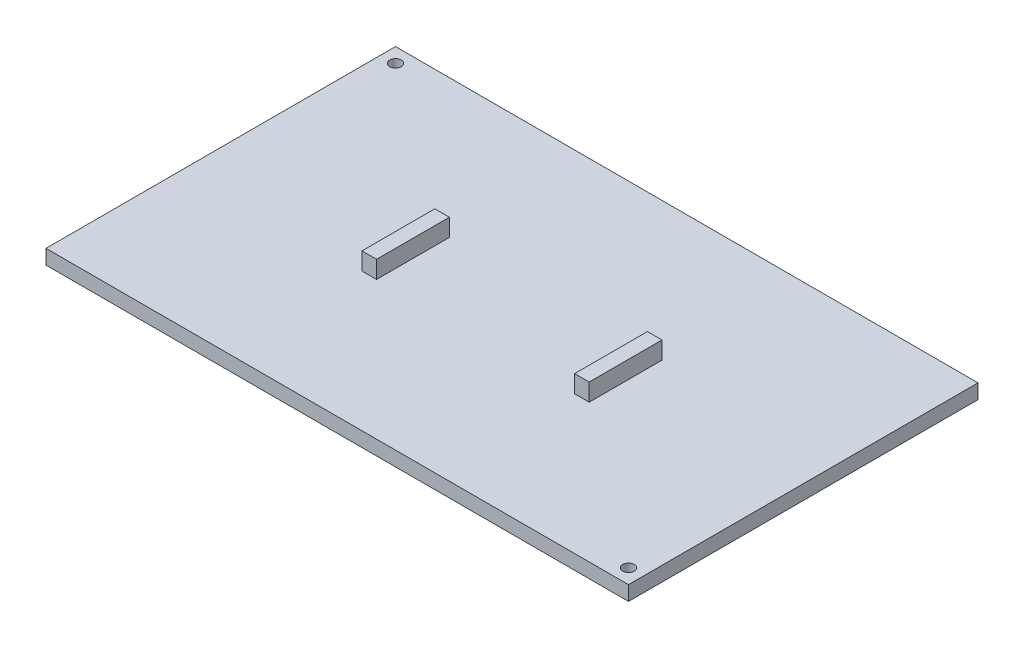
from build123d import *

# Parameters (mm, degrees)
SKETCH2_W           = 100
SKETCH2_H           = 60
BOSS_EXTRUDE1_DEPTH = 2.5
SKETCH5_W           = 2.5
SKETCH5_H           = 12.508
BOSS_EXTRUDE2_DEPTH = 3
SKETCH6_R           = 1
CUT_EXTRUDE1_DEPTH  = 3


with BuildPart() as part:
    # Sketch2 → Boss-Extrude1 (new body)
    with BuildSketch(Plane(origin=(0, 0, 0), x_dir=(1, 0, 0), z_dir=(0, 1, 0))):
        Rectangle(SKETCH2_W, SKETCH2_H)
    extrude(amount=BOSS_EXTRUDE1_DEPTH)

    # Sketch5 → Boss-Extrude2 (add)
    with BuildSketch(Plane(origin=(0, 2.5, 0), x_dir=(1, 0, 0), z_dir=(0, 1, 0))):
        with Locations((-18.25, 0)):
            Rectangle(SKETCH5_W, SKETCH5_H)
        with Locations((18.25, 0)):
            Rectangle(SKETCH5_W, SKETCH5_H)
    extrude(amount=BOSS_EXTRUDE2_DEPTH)

    # Sketch6 → Cut-Extrude1 (cut)
    with BuildSketch(Plane(origin=(0, 2.5, 0), x_dir=(1, 0, 0), z_dir=(0, 1, 0))):
        with Locations((47.5, -27.5)):
            Circle(SKETCH6_R)
        with Locations((-47.5, 27.5)):
            Circle(SKETCH6_R)
    extrude(amount=-CUT_EXTRUDE1_DEPTH, mode=Mode.SUBTRACT)


solid = part.part
